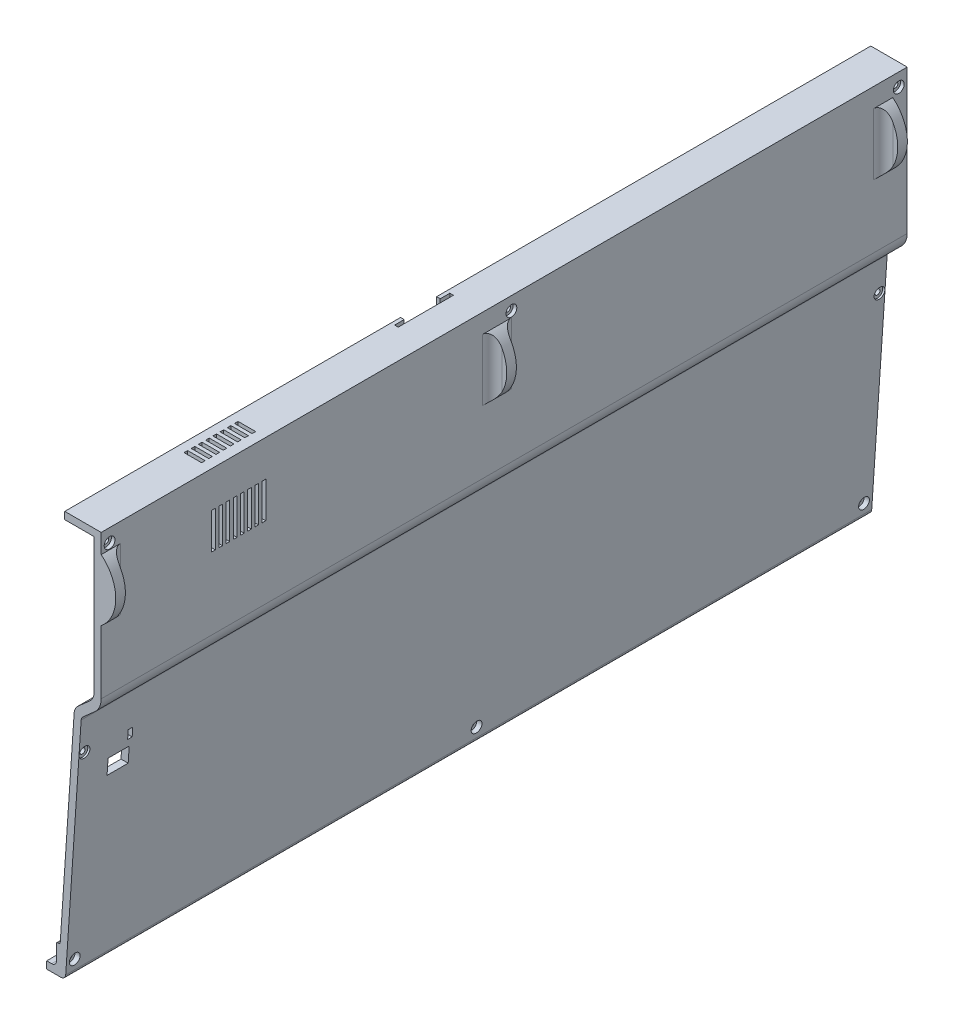
from build123d import *

# Parameters (mm, degrees)
BOTTOMPLATE_DEPTH         = 6
BOTTOMPLATE_DEPTH_BACK    = 329.5
FPGABASE_R                = 3.783115
FPGABASE_R_2              = 1
FPGABASE_R_3              = 3.75
FPGASUPPORTBOTTOM_DEPTH   = 3.3
SKETCH19_W                = 7.304851
SKETCH19_H                = 1.5
AIRVENTBACK_DEPTH         = 10
SKETCH20_W                = 1.5
SKETCH20_H                = 15
AIRVENTBOTTOM_DEPTH       = 4
RIGHTLEG_DEPTH            = 4
SKETCH25_W                = 196.081057
SKETCH25_H                = 1.5
UPPPERFINS_DEPTH          = 2
UPPERFINFILLET_R          = 2
SKETCH32_W                = 83.74
SKETCH32_H                = 41.6
FPGASUPPORTFRAME_DEPTH    = 1.5
FPGASCREWHOLES_DEPTH      = 1
FPGASCREWHOLES_DEPTH_BACK = 1
SKETCH39_R                = 1
SKETCH41_W                = 15
SKETCH41_H                = 10
SDCARDHOLE_DEPTH          = 3
SDCARDBASE_REACH          = 1078.023
SKETCH42_W                = 25
SKETCH42_H                = 22
MIDLEG_DEPTH              = 2
MIDLEG_DEPTH_BACK         = 2
LEGFILLET_R               = 4
PCBSUPPORTBOTTOM_REACH    = 1078.152
SKETCH54_R                = 4
SKETCH54_R_2              = 0.9
BOSS_EXTRUDE1_REACH       = 1078.152
SKETCH55_W                = 7.644012
SKETCH55_H                = 6.202068
SKETCH55_W_2              = 11.231182
SKETCH55_H_2              = 4.760292
SKETCH56_R                = 0.9
PCBTOPSCREW_DEPTH         = 7
SKETCH57_W                = 1.884644
SKETCH57_H                = 3.674644
CUT_EXTRUDE2_DEPTH        = 10
SKETCH58_W                = 8.795038
SKETCH58_H                = 6.418001
CUT_EXTRUDE3_DEPTH        = 10
SKETCH60_R                = 2.25
BOTTOMHOLEHEAD_DEPTH      = 3
BOTTOMSCREWHOLES_REACH    = 1078.108
SKETCH61_R                = 1.1
SKETCH62_R                = 2.25
CUT_EXTRUDE6_DEPTH        = 1.5
CUT_EXTRUDE7_REACH        = 1078.077
SKETCH63_R                = 1.1
SKETCH64_R                = 2.25
CUT_EXTRUDE8_DEPTH        = 1.5
CUT_EXTRUDE9_REACH        = 1077.99
SKETCH65_R                = 1.1
CUT_EXTRUDE10_REACH       = 1402.889
SKETCH66_W                = 1.5
SKETCH66_H                = 4
SNAP_START                = 859.986062
SNAP_GROOVE1_DEPTH        = 1.5
SNAP_START_2              = 858.986062
SNAP_GROOVE1_2_DEPTH      = 1
SNAP_GROOVE2_DEPTH        = 1.5
SNAP_GROOVE2_2_DEPTH      = 1
SNAP_START_3              = 1022.593601
SNAP_GROOVE3_DEPTH        = 1.002144
SNAP_GROOVE3_2_DEPTH      = 0.002144
SNAP_START_4              = 1022.59362
SNAP_GROOVE4_DEPTH        = 1.002125
SNAP_GROOVE4_2_DEPTH      = 0.002144


# Read off the part's stored shape, not the designer's step: Snap Groove1, Snap Groove2, Snap Groove3, Snap Groove4
with BuildPart() as part:
    # bottomprofile → bottomplate (new, two sides: drawn at the far end of the back side and taken through both)
    with BuildSketch(Plane.XY.offset(5).offset(-BOTTOMPLATE_DEPTH_BACK)):
        with BuildLine():
            Line((-1342.155213, 1022.76448), (-1332.982661, 1022.76448))
            Line((-1332.982661, 1022.76448), (-1332.982661, 966.425447))
            ThreePointArc((-1332.982661, 966.425447), (-1333.425472, 964.368258), (-1334.675472, 962.675447))
            Line((-1334.675472, 962.675447), (-1339.565613, 958.362748))
            ThreePointArc((-1339.565613, 958.362748), (-1340.743564, 956.822616), (-1341.247026, 954.950157))
            Line((-1341.247026, 954.950157), (-1347.044065, 869.240564))
            ThreePointArc((-1347.044065, 869.240564), (-1347.20151, 868.909017), (-1347.542926, 868.774305))
            Line((-1347.542926, 868.774305), (-1348.116307, 868.774305))
            ThreePointArc((-1348.116307, 868.774305), (-1348.46986, 868.627859), (-1348.616307, 868.274305))
            Line((-1348.616307, 868.274305), (-1348.616307, 865.724305))
            Line((-1348.616307, 865.724305), (-1348.616307, 861.986062))
            ThreePointArc((-1348.616307, 861.986062), (-1349.202093, 860.571848), (-1350.616307, 859.986062))
            Line((-1350.616307, 859.986062), (-1352.666238, 859.986062))
            Line((-1352.666238, 859.986062), (-1352.666238, 856.986062))
            Line((-1352.666238, 856.986062), (-1346.753009, 856.986062))
            ThreePointArc((-1346.753009, 856.986062), (-1345.387346, 857.52491), (-1344.757568, 858.851098))
            Line((-1344.757568, 858.851098), (-1344.267986, 866.089595))
            Line((-1344.267986, 866.089595), (-1338.325401, 953.951092))
            ThreePointArc((-1338.325401, 953.951092), (-1338.105085, 954.770486), (-1337.58961, 955.444452))
            Line((-1337.58961, 955.444452), (-1332.691159, 959.76448))
            ThreePointArc((-1332.691159, 959.76448), (-1330.691159, 962.472977), (-1329.982661, 965.76448))
            Line((-1329.982661, 965.76448), (-1329.982661, 1025.76448))
            Line((-1329.982661, 1025.76448), (-1345.155213, 1025.76448))
            Line((-1345.155213, 1025.76448), (-1345.155213, 1022.76448))
            Line((-1345.155213, 1022.76448), (-1342.155213, 1022.76448))
        make_face()
    extrude(amount=BOTTOMPLATE_DEPTH + BOTTOMPLATE_DEPTH_BACK)

    # fpgabase → fpgasupportbottom (add)
    # profile 1 of 4: a face of its own
    with BuildSketch(Plane.ZY.offset(1332.982661)):
        with Locations(Location((-84.600637, 968.943514, 0), (0, 0, 221.728888))):
            Circle(FPGABASE_R)
        with Locations(Location((-84.600637, 968.943514, 0), (0, 0, 270))):
            Circle(FPGABASE_R_2, mode=Mode.SUBTRACT)
    # profile 2 of 4: a face of its own
    with BuildSketch(Plane.ZY.offset(1332.982661)):
        with Locations(Location((-84.580213, 1013.960436, 0), (0, 0, 90))):
            Circle(FPGABASE_R_3)
        with Locations(Location((-84.580213, 1013.960436, 0), (0, 0, 270))):
            Circle(FPGABASE_R_2, mode=Mode.SUBTRACT)
    # profile 3 of 4: a face of its own
    with BuildSketch(Plane.ZY.offset(1332.982661)):
        with Locations(Location((2.559787, 1013.960436, 0), (0, 0, 90))):
            Circle(FPGABASE_R_3)
        with Locations(Location((2.559787, 1013.960436, 0), (0, 0, 270))):
            Circle(FPGABASE_R_2, mode=Mode.SUBTRACT)
    # profile 4 of 4: a face of its own
    with BuildSketch(Plane.ZY.offset(1332.982661)):
        with Locations(Location((2.559787, 968.943514, 0), (0, 0, 222.181745))):
            Circle(FPGABASE_R_3)
        with Locations(Location((2.559787, 968.943514, 0), (0, 0, 270))):
            Circle(FPGABASE_R_2, mode=Mode.SUBTRACT)
    extrude(amount=FPGASUPPORTBOTTOM_DEPTH)

    # Sketch19 → airventback (cut)
    with BuildSketch(Plane(origin=(0, 1025.76448, 0), x_dir=(1, 0, 0), z_dir=(0, 1, 0))):
        with Locations((-1337.852643, 35.75)):
            Rectangle(SKETCH19_W, SKETCH19_H)
        with Locations((-1337.852643, 38.75)):
            Rectangle(SKETCH19_W, SKETCH19_H)
        with Locations((-1337.852643, 41.75)):
            Rectangle(SKETCH19_W, SKETCH19_H)
        with Locations((-1337.852643, 44.75)):
            Rectangle(SKETCH19_W, SKETCH19_H)
        with Locations((-1337.852643, 47.75)):
            Rectangle(SKETCH19_W, SKETCH19_H)
        with Locations((-1337.852643, 50.75)):
            Rectangle(SKETCH19_W, SKETCH19_H)
        with Locations((-1337.852643, 53.75)):
            Rectangle(SKETCH19_W, SKETCH19_H)
        with Locations((-1337.852643, 56.75)):
            Rectangle(SKETCH19_W, SKETCH19_H)
    extrude(amount=-AIRVENTBACK_DEPTH, mode=Mode.SUBTRACT)

    # Sketch20 → airventbottom (cut)
    with BuildSketch(Plane(origin=(-1329.982661, 0, 0), x_dir=(0, 0, -1), z_dir=(1, 0, 0))):
        with Locations((38.75, 1003.216334)):
            Rectangle(SKETCH20_W, SKETCH20_H)
        with Locations((35.75, 1003.216334)):
            Rectangle(SKETCH20_W, SKETCH20_H)
        with Locations((41.75, 1003.216334)):
            Rectangle(SKETCH20_W, SKETCH20_H)
        with Locations((44.75, 1003.216334)):
            Rectangle(SKETCH20_W, SKETCH20_H)
        with Locations((47.75, 1003.216334)):
            Rectangle(SKETCH20_W, SKETCH20_H)
        with Locations((50.75, 1003.216334)):
            Rectangle(SKETCH20_W, SKETCH20_H)
        with Locations((53.75, 1003.216334)):
            Rectangle(SKETCH20_W, SKETCH20_H)
        with Locations((56.75, 1003.216334)):
            Rectangle(SKETCH20_W, SKETCH20_H)
    extrude(amount=-AIRVENTBOTTOM_DEPTH, mode=Mode.SUBTRACT)

    # Sketch22 → rightleg (add)
    with BuildSketch(Plane.XY.offset(11)):
        with BuildLine():
            Line((-1329.982661, 1017.76448), (-1329.982661, 992.11848))
            ThreePointArc((-1329.982661, 992.11848), (-1323.916059, 1004.94148), (-1329.982661, 1017.76448))
        make_face()
    rightleg = extrude(amount=-RIGHTLEG_DEPTH)

    # legmirror: rightleg across plane
    add(rightleg.mirror(Plane.XY.offset(-153.75)))

    # Sketch25 → uppperfins (add)
    with BuildSketch(Plane.ZY.offset(1332.982661)):
        with Locations((-218.372321, 1013.01448)):
            Rectangle(SKETCH25_W, SKETCH25_H)
        with Locations((-218.372321, 1004.389837)):
            Rectangle(SKETCH25_W, SKETCH25_H)
        with Locations((-218.372321, 995.765193)):
            Rectangle(SKETCH25_W, SKETCH25_H)
        with Locations((-218.372321, 987.14055)):
            Rectangle(SKETCH25_W, SKETCH25_H)
    extrude(amount=UPPPERFINS_DEPTH)

    # upperfinfillet
    upperfinfillet_edges = [part.edges().sort_by_distance(p)[0] for p in [
        (-1332.982661, 1013.76448, -218.372321),
        (-1332.982661, 1005.139837, -218.372321),
        (-1332.982661, 996.515193, -218.372321),
        (-1332.982661, 987.89055, -218.372321),
        (-1332.982661, 986.39055, -218.372321),
        (-1332.982661, 995.015193, -218.372321),
        (-1332.982661, 1003.639837, -218.372321),
        (-1332.982661, 1012.26448, -218.372321),
    ]]
    fillet(upperfinfillet_edges, radius=UPPERFINFILLET_R - 0.0001)  # a hair under: the kernel refuses the full size

    # Sketch32 → fpgasupportframe (add)
    with BuildSketch(Plane.ZY.offset(1332.982661)):
        with BuildLine():
            Line((-84.880213, 1017.260436), (2.859787, 1017.260436))
            ThreePointArc((2.859787, 1017.260436), (4.981107, 1016.381756), (5.859787, 1014.260436))
            Line((5.859787, 1014.260436), (5.859787, 968.660436))
            ThreePointArc((5.859787, 968.660436), (4.981107, 966.539116), (2.859787, 965.660436))
            Line((2.859787, 965.660436), (-84.880213, 965.660436))
            ThreePointArc((-84.880213, 965.660436), (-87.001534, 966.539116), (-87.880213, 968.660436))
            Line((-87.880213, 968.660436), (-87.880213, 1014.260436))
            ThreePointArc((-87.880213, 1014.260436), (-87.001534, 1016.381756), (-84.880213, 1017.260436))
        make_face()
        with Locations((-41.010213, 991.460436)):
            Rectangle(SKETCH32_W, SKETCH32_H, mode=Mode.SUBTRACT)
    extrude(amount=FPGASUPPORTFRAME_DEPTH)

    # Sketch39 → fpgascrewholes (cut, two sides: drawn at the far end of the back side and taken through both)
    with BuildSketch(Plane.ZY.offset(1334.482661).offset(-FPGASCREWHOLES_DEPTH_BACK)):
        with Locations((-91.64829, 1013.960436)):
            Circle(SKETCH39_R)
        with Locations(Location((-4.50829, 1013.960436, 0), (0, 0, 90))):
            Circle(SKETCH39_R)
        with Locations(Location((-4.508288, 968.960434, 0), (0, 0, 90))):
            Circle(SKETCH39_R)
        with Locations((-91.64829, 968.960436)):
            Circle(SKETCH39_R)
    extrude(amount=FPGASCREWHOLES_DEPTH + FPGASCREWHOLES_DEPTH_BACK, mode=Mode.SUBTRACT)

    # Sketch41 → sdcardhole (cut)
    with BuildSketch(Plane.ZY.offset(1345.155213)):
        with Locations((-136.301965, 1024.403378)):
            Rectangle(SKETCH41_W, SKETCH41_H)
    extrude(amount=-SDCARDHOLE_DEPTH, mode=Mode.SUBTRACT)

    # Sketch42 → sdcardbase (add, up to next)
    with BuildSketch(Plane.ZY.offset(1342.155213), mode=Mode.PRIVATE) as sdcardbase_sk1:
        with Locations((-136.301965, 1014.76448)):
            Rectangle(SKETCH42_W, SKETCH42_H)
    sdcardbase_tool1 = extrude(sdcardbase_sk1.sketch, amount=-SDCARDBASE_REACH, mode=Mode.PRIVATE) - part.part
    add(sdcardbase_tool1.solids().sort_by_distance((-1342.155213, 1014.76448, -136.301965))[0])

    # Sketch43 → midleg (add, two sides: drawn at the far end of the back side and taken through both)
    with BuildSketch(Plane.XY.offset(-153.75).offset(-MIDLEG_DEPTH_BACK)):
        with BuildLine():
            Line((-1329.982661, 1017.76448), (-1331.368993, 1017.76448))
            Line((-1331.368993, 1017.76448), (-1331.368993, 992.11848))
            Line((-1331.368993, 992.11848), (-1329.982661, 992.11848))
            ThreePointArc((-1329.982661, 992.11848), (-1323.916059, 1004.94148), (-1329.982661, 1017.76448))
        make_face()
    extrude(amount=MIDLEG_DEPTH + MIDLEG_DEPTH_BACK)

    # legfillet
    legfillet_edges = [part.edges().sort_by_distance(p)[0] for p in [
        (-1329.982661, 1004.94148, 7),
        (-1329.982661, 1004.94148, -314.5),
        (-1329.982661, 1004.94148, -151.75),
        (-1329.982661, 1004.94148, -155.75),
    ]]
    fillet(legfillet_edges, radius=LEGFILLET_R - 0.0001)  # a hair under: the kernel refuses the full size

    # Sketch54 → pcbsupportbottom (add, up to next)
    with BuildSketch(Plane.ZY.offset(1348.616307), mode=Mode.PRIVATE) as pcbsupportbottom_sk1:
        with Locations((-315.5, 870.024305)):
            Circle(SKETCH54_R)
        with Locations((-315.5, 870.024305)):
            Circle(SKETCH54_R_2, mode=Mode.SUBTRACT)
    pcbsupportbottom_tool1 = extrude(pcbsupportbottom_sk1.sketch, amount=-PCBSUPPORTBOTTOM_REACH, mode=Mode.PRIVATE) - part.part
    # Sketch54 → pcbsupportbottom (add, up to next)
    with BuildSketch(Plane.ZY.offset(1348.616307), mode=Mode.PRIVATE) as pcbsupportbottom_sk2:
        with Locations((-3.9, 870.024305)):
            Circle(SKETCH54_R)
        with Locations((-3.9, 870.024305)):
            Circle(SKETCH54_R_2, mode=Mode.SUBTRACT)
    pcbsupportbottom_tool2 = extrude(pcbsupportbottom_sk2.sketch, amount=-PCBSUPPORTBOTTOM_REACH, mode=Mode.PRIVATE) - part.part
    add(pcbsupportbottom_tool1.solids().sort_by_distance((-1348.616307, 870.024305, -319.386863))[0])
    add(pcbsupportbottom_tool2.solids().sort_by_distance((-1348.616307, 870.024305, -7.786863))[0])

    # Sketch55 → Boss-Extrude1 (add, up to next)
    with BuildSketch(Plane(origin=(-1348.616307, 0, 0), x_dir=(0, 0, -1), z_dir=(1, 0, 0)), mode=Mode.PRIVATE) as boss_extrude1_sk1:
        with Locations((315.381858, 969.000827)):
            Rectangle(SKETCH55_W, SKETCH55_H)
    boss_extrude1_tool1 = extrude(boss_extrude1_sk1.sketch, amount=BOSS_EXTRUDE1_REACH, mode=Mode.PRIVATE) - part.part
    # Sketch55 → Boss-Extrude1 (add, up to next)
    with BuildSketch(Plane(origin=(-1348.616307, 0, 0), x_dir=(0, 0, -1), z_dir=(1, 0, 0)), mode=Mode.PRIVATE) as boss_extrude1_sk2:
        with Locations((6.988959, 945.874068)):
            Rectangle(SKETCH55_W_2, SKETCH55_H_2)
    boss_extrude1_tool2 = extrude(boss_extrude1_sk2.sketch, amount=BOSS_EXTRUDE1_REACH, mode=Mode.PRIVATE) - part.part
    add(boss_extrude1_tool1.solids().sort_by_distance((-1348.616307, 969.000827, -315.381858))[0])
    add(boss_extrude1_tool2.solids().sort_by_distance((-1348.616307, 945.874068, -6.988959))[0])

    # Sketch56 → pcbtopscrew (cut)
    with BuildSketch(Plane.ZY.offset(1348.616307)):
        with Locations((-315.5, 967.774305)):
            Circle(SKETCH56_R)
    extrude(amount=-PCBTOPSCREW_DEPTH, mode=Mode.SUBTRACT)

    # Sketch57 → Cut-Extrude2 (cut)
    with BuildSketch(Plane(origin=(-1346.031307, 0, 0), x_dir=(0, 0, -1), z_dir=(1, 0, 0))):
        with Locations((10.5, 937.899305)):
            Rectangle(SKETCH57_W, SKETCH57_H)
    extrude(amount=CUT_EXTRUDE2_DEPTH, mode=Mode.SUBTRACT)

    # Sketch58 → Cut-Extrude3 (cut)
    with BuildSketch(Plane(origin=(-1345.991307, 0, 0), x_dir=(0, 0, -1), z_dir=(1, 0, 0))):
        with Locations((6.009656, 929.984934)):
            Rectangle(SKETCH58_W, SKETCH58_H)
    extrude(amount=CUT_EXTRUDE3_DEPTH, mode=Mode.SUBTRACT)

    # Sketch60 → bottomholehead (cut)
    with BuildSketch(Plane.ZY.offset(1343.616307)):
        with Locations(Location((-321, 862.986062, 0), (0, 0, 90))):
            Circle(SKETCH60_R)
        with Locations(Location((-159.75, 862.986062, 0), (0, 0, 90))):
            Circle(SKETCH60_R)
        with Locations(Location((7.5, 862.986062, 0), (0, 0, 90))):
            Circle(SKETCH60_R)
    extrude(amount=BOTTOMHOLEHEAD_DEPTH, mode=Mode.SUBTRACT)

    # Sketch61 → bottomscrewholes (cut, up to next)
    with BuildSketch(Plane(origin=(-1346.616307, 0, 0), x_dir=(0, 0, -1), z_dir=(1, 0, 0)), mode=Mode.PRIVATE) as bottomscrewholes_sk1:
        with Locations((-7.5, 862.986062)):
            Circle(SKETCH61_R)
    bottomscrewholes_tool1 = extrude(bottomscrewholes_sk1.sketch, amount=-BOTTOMSCREWHOLES_REACH, mode=Mode.PRIVATE) & part.part
    # Sketch61 → bottomscrewholes (cut, up to next)
    with BuildSketch(Plane(origin=(-1346.616307, 0, 0), x_dir=(0, 0, -1), z_dir=(1, 0, 0)), mode=Mode.PRIVATE) as bottomscrewholes_sk2:
        with Locations((159.75, 862.986062)):
            Circle(SKETCH61_R)
    bottomscrewholes_tool2 = extrude(bottomscrewholes_sk2.sketch, amount=-BOTTOMSCREWHOLES_REACH, mode=Mode.PRIVATE) & part.part
    # Sketch61 → bottomscrewholes (cut, up to next)
    with BuildSketch(Plane(origin=(-1346.616307, 0, 0), x_dir=(0, 0, -1), z_dir=(1, 0, 0)), mode=Mode.PRIVATE) as bottomscrewholes_sk3:
        with Locations((321, 862.986062)):
            Circle(SKETCH61_R)
    bottomscrewholes_tool3 = extrude(bottomscrewholes_sk3.sketch, amount=-BOTTOMSCREWHOLES_REACH, mode=Mode.PRIVATE) & part.part
    add(bottomscrewholes_tool1.solids().sort_by_distance((-1346.616307, 862.986062, 7.5))[0], mode=Mode.SUBTRACT)
    add(bottomscrewholes_tool2.solids().sort_by_distance((-1346.616307, 862.986062, -159.75))[0], mode=Mode.SUBTRACT)
    add(bottomscrewholes_tool3.solids().sort_by_distance((-1346.616307, 862.986062, -321))[0], mode=Mode.SUBTRACT)

    # Sketch62 → Cut-Extrude6 (cut)
    with BuildSketch(Plane(origin=(-1329.982661, 0, 0), x_dir=(0, 0, -1), z_dir=(1, 0, 0))):
        with Locations(Location((-7.5, 1020.26448, 0), (0, 0, 90))):
            Circle(SKETCH62_R)
        with Locations(Location((159.75, 1020.26448, 0), (0, 0, 90))):
            Circle(SKETCH62_R)
        with Locations(Location((321, 1020.26448, 0), (0, 0, 90))):
            Circle(SKETCH62_R)
    extrude(amount=-CUT_EXTRUDE6_DEPTH, mode=Mode.SUBTRACT)

    # Sketch63 → Cut-Extrude7 (cut, up to next)
    with BuildSketch(Plane(origin=(-1331.482661, 0, 0), x_dir=(0, 0, -1), z_dir=(1, 0, 0)), mode=Mode.PRIVATE) as cut_extrude7_sk1:
        with Locations(Location((-7.5, 1020.26448, 0), (0, 0, 90))):
            Circle(SKETCH63_R)
    cut_extrude7_tool1 = extrude(cut_extrude7_sk1.sketch, amount=-CUT_EXTRUDE7_REACH, mode=Mode.PRIVATE) & part.part
    # Sketch63 → Cut-Extrude7 (cut, up to next)
    with BuildSketch(Plane(origin=(-1331.482661, 0, 0), x_dir=(0, 0, -1), z_dir=(1, 0, 0)), mode=Mode.PRIVATE) as cut_extrude7_sk2:
        with Locations(Location((159.75, 1020.26448, 0), (0, 0, 90))):
            Circle(SKETCH63_R)
    cut_extrude7_tool2 = extrude(cut_extrude7_sk2.sketch, amount=-CUT_EXTRUDE7_REACH, mode=Mode.PRIVATE) & part.part
    # Sketch63 → Cut-Extrude7 (cut, up to next)
    with BuildSketch(Plane(origin=(-1331.482661, 0, 0), x_dir=(0, 0, -1), z_dir=(1, 0, 0)), mode=Mode.PRIVATE) as cut_extrude7_sk3:
        with Locations(Location((321, 1020.26448, 0), (0, 0, 90))):
            Circle(SKETCH63_R)
    cut_extrude7_tool3 = extrude(cut_extrude7_sk3.sketch, amount=-CUT_EXTRUDE7_REACH, mode=Mode.PRIVATE) & part.part
    add(cut_extrude7_tool1.solids().sort_by_distance((-1331.482661, 1020.26448, 7.5))[0], mode=Mode.SUBTRACT)
    add(cut_extrude7_tool2.solids().sort_by_distance((-1331.482661, 1020.26448, -159.75))[0], mode=Mode.SUBTRACT)
    add(cut_extrude7_tool3.solids().sort_by_distance((-1331.482661, 1020.26448, -321))[0], mode=Mode.SUBTRACT)

    # Sketch64 → Cut-Extrude8 (cut)
    with BuildSketch(Plane(origin=(-1338.616307, 0, 0), x_dir=(0, 0, -1), z_dir=(1, 0, 0))):
        with Locations((-8.7, 940.76448)):
            Circle(SKETCH64_R)
        with Locations((322.2, 940.76448)):
            Circle(SKETCH64_R)
    extrude(amount=-CUT_EXTRUDE8_DEPTH, mode=Mode.SUBTRACT)

    # Cut-Extrude9: up to this plane
    cut_extrude9_end = Plane(origin=(-1341.247026, 954.950157, 11), z_dir=(0.9977205152029662, -0.06748165338169884, 0))
    # Sketch65 → Cut-Extrude9 (cut, up to the surface)
    with BuildSketch(Plane(origin=(-1340.116307, 0, 0), x_dir=(0, 0, -1), z_dir=(1, 0, 0)), mode=Mode.PRIVATE) as cut_extrude9_sk1:
        with Locations((-8.7, 940.76448)):
            Circle(SKETCH65_R)
    cut_extrude9_tool1 = split(extrude(cut_extrude9_sk1.sketch, amount=-CUT_EXTRUDE9_REACH, mode=Mode.PRIVATE), bisect_by=cut_extrude9_end, keep=Keep.BOTH, mode=Mode.PRIVATE)
    add(cut_extrude9_tool1.solids().sort_by_distance((-1340.116307, 940.76448, 8.7))[0], mode=Mode.SUBTRACT)
    # Sketch65 → Cut-Extrude9 (cut, up to the surface)
    with BuildSketch(Plane(origin=(-1340.116307, 0, 0), x_dir=(0, 0, -1), z_dir=(1, 0, 0)), mode=Mode.PRIVATE) as cut_extrude9_sk2:
        with Locations((322.2, 940.76448)):
            Circle(SKETCH65_R)
    cut_extrude9_tool2 = split(extrude(cut_extrude9_sk2.sketch, amount=-CUT_EXTRUDE9_REACH, mode=Mode.PRIVATE), bisect_by=cut_extrude9_end, keep=Keep.BOTH, mode=Mode.PRIVATE)
    add(cut_extrude9_tool2.solids().sort_by_distance((-1340.116307, 940.76448, -322.2))[0], mode=Mode.SUBTRACT)

    # Sketch66 → Cut-Extrude10 (cut, up to next)
    with BuildSketch(Plane.XZ.offset(-1022.76448), mode=Mode.PRIVATE) as cut_extrude10_sk1:
        with Locations((-1342.905213, -126.801965)):
            Rectangle(SKETCH66_W, SKETCH66_H)
    cut_extrude10_tool1 = extrude(cut_extrude10_sk1.sketch, amount=-CUT_EXTRUDE10_REACH, mode=Mode.PRIVATE) & part.part
    # Sketch66 → Cut-Extrude10 (cut, up to next)
    with BuildSketch(Plane.XZ.offset(-1022.76448), mode=Mode.PRIVATE) as cut_extrude10_sk2:
        with Locations((-1342.905213, -145.801965)):
            Rectangle(SKETCH66_W, SKETCH66_H)
    cut_extrude10_tool2 = extrude(cut_extrude10_sk2.sketch, amount=-CUT_EXTRUDE10_REACH, mode=Mode.PRIVATE) & part.part
    add(cut_extrude10_tool1.solids().sort_by_distance((-1342.905213, 1022.76448, -126.801965))[0], mode=Mode.SUBTRACT)
    add(cut_extrude10_tool2.solids().sort_by_distance((-1342.905213, 1022.76448, -145.801965))[0], mode=Mode.SUBTRACT)

    # Snap Groove1 outline → Snap Groove1 (cut)
    with BuildSketch(Plane(origin=(0, 0, 0), x_dir=(1, 0, 0), z_dir=(0, 1, 0)).offset(SNAP_START)):
        Polygon((-1348.566238, 77.421294), (-1348.566238, 85.810812), (-1350.616307, 85.918252), (-1351, 85.93836), (-1351, 77.293746), (-1350.616307, 77.313854), align=None)
    extrude(amount=SNAP_GROOVE1_DEPTH, mode=Mode.SUBTRACT)

    # Snap Groove1 2 outline → Snap Groove1 2 (cut)
    with BuildSketch(Plane(origin=(0, 0, 0), x_dir=(1, 0, 0), z_dir=(0, 1, 0)).offset(SNAP_START_2)):
        Polygon((-1348.566238, 77.421294), (-1348.566238, 85.810812), (-1349.666238, 85.868461), (-1349.666238, 77.363645), align=None)
    extrude(amount=SNAP_GROOVE1_2_DEPTH, mode=Mode.SUBTRACT)

    # Snap Groove2 outline → Snap Groove2 (cut)
    with BuildSketch(Plane(origin=(0, 0, 0), x_dir=(1, 0, 0), z_dir=(0, 1, 0)).offset(SNAP_START)):
        Polygon((-1348.566238, 243.364024), (-1350.616307, 243.471463), (-1351, 243.491572), (-1351, 234.846957), (-1350.616307, 234.867066), (-1348.566238, 234.974505), align=None)
    extrude(amount=SNAP_GROOVE2_DEPTH, mode=Mode.SUBTRACT)

    # Snap Groove2 2 outline → Snap Groove2 2 (cut)
    with BuildSketch(Plane(origin=(0, 0, 0), x_dir=(1, 0, 0), z_dir=(0, 1, 0)).offset(SNAP_START_2)):
        Polygon((-1348.566238, 243.364024), (-1349.666238, 243.421672), (-1349.666238, 234.916857), (-1348.566238, 234.974505), align=None)
    extrude(amount=SNAP_GROOVE2_2_DEPTH, mode=Mode.SUBTRACT)

    # Snap Groove3 outline → Snap Groove3 (cut)
    with BuildSketch(Plane(origin=(0, 0, 0), x_dir=(0.9999999919201399, -0.0001271208877673, 0), z_dir=(0.0001271208877673, 0.99999999192014, 0)).offset(SNAP_START_3)):
        Polygon((-1341.186227, 95.575366), (-1341.186227, 103.964884), (-1342.286227, 104.022533), (-1342.286227, 95.517717), align=None)
    extrude(amount=SNAP_GROOVE3_DEPTH, mode=Mode.SUBTRACT)

    # Snap Groove3 2 outline → Snap Groove3 2 (cut)
    with BuildSketch(Plane(origin=(0, 0, 0), x_dir=(0.9999999919201399, -0.0001271208877673, 0), z_dir=(0.0001271208877673, 0.99999999192014, 0)).offset(SNAP_START_3)):
        Polygon((-1342.286227, 95.517717), (-1342.286227, 104.022533), (-1344.286227, 104.127348), (-1344.286227, 95.412902), align=None)
    extrude(amount=SNAP_GROOVE3_2_DEPTH, mode=Mode.SUBTRACT)

    # Snap Groove4 outline → Snap Groove4 (cut)
    with BuildSketch(Plane(origin=(0, 0, 0), x_dir=(0.9999999919201399, -0.0001271208877673, 0), z_dir=(0.0001271208877673, 0.99999999192014, 0)).offset(SNAP_START_4)):
        Polygon((-1342.286227, 230.68523), (-1341.186227, 230.742879), (-1341.186227, 239.132397), (-1342.286227, 239.190046), align=None)
    extrude(amount=SNAP_GROOVE4_DEPTH, mode=Mode.SUBTRACT)

    # Snap Groove4 2 outline → Snap Groove4 2 (cut)
    with BuildSketch(Plane(origin=(0, 0, 0), x_dir=(0.9999999919201399, -0.0001271208877673, 0), z_dir=(0.0001271208877673, 0.99999999192014, 0)).offset(SNAP_START_3)):
        Polygon((-1344.286227, 230.580415), (-1342.286227, 230.68523), (-1342.286227, 239.190046), (-1344.286227, 239.294861), align=None)
    extrude(amount=SNAP_GROOVE4_2_DEPTH, mode=Mode.SUBTRACT)


solid = part.part
